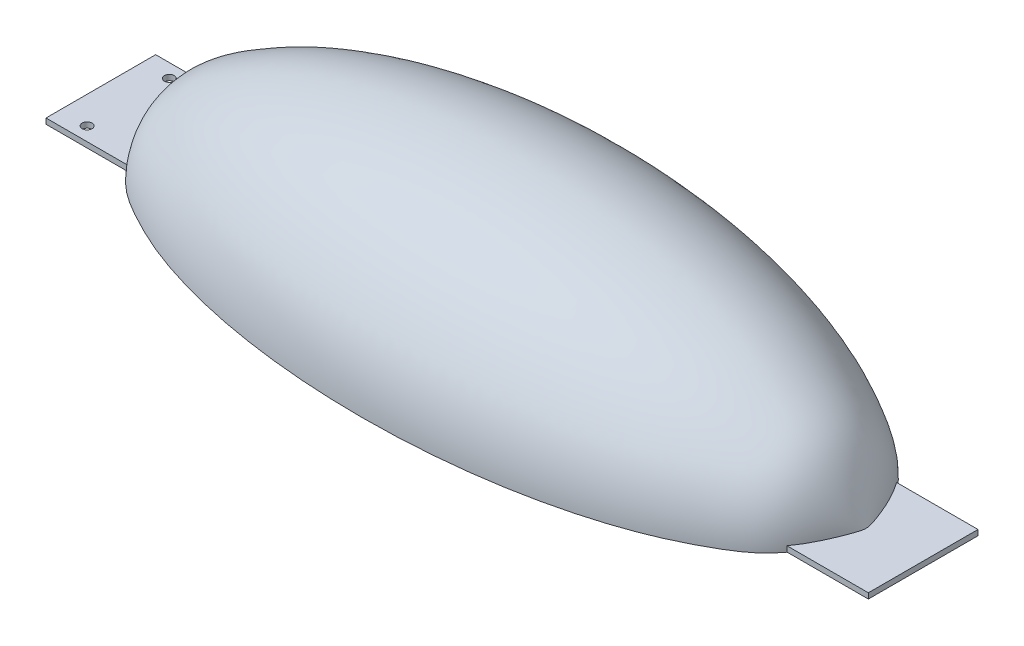
from build123d import *

# Parameters (mm, degrees)
SKETCH2_W           = 360
SKETCH2_H           = 160
CUT_EXTRUDE1_DEPTH  = 80
SKETCH3_W           = 30
SKETCH3_H           = 40
BOSS_EXTRUDE1_DEPTH = 2
SKETCH4_R           = 1.8
CUT_EXTRUDE2_DEPTH  = 3


with BuildPart() as part:
    # Sketch1 → Revolve1 (revolve)
    with BuildSketch(Plane.XY):
        with BuildLine():
            Line((-260, 0), (0, 0))
            add(Edge.make_bspline(
                [(0, 0), (-3.347287608, 8.830491747), (-8.637057756, 22.785453825), (-25.560999876, 33.02157361), (-38.692183286, 39.434199177), (-51.852349815, 44.123794884), (-64.89948422, 47.74936681), (-77.936573384, 50.514956153), (-90.95830586, 52.566616186), (-103.974926365, 53.983885889), (-116.988117972, 54.816743473), (-130, 55.091544132), (-143.011882028, 54.816743473), (-156.025073635, 53.983885889), (-169.04169414, 52.566616186), (-182.063426616, 50.514956153), (-195.10051578, 47.74936681), (-208.147650185, 44.123794884), (-221.307816714, 39.434199177), (-234.439000124, 33.02157361), (-251.362942244, 22.785453825), (-256.652712392, 8.830491747), (-260, 0)],
                knots=[0, 0, 0, 0, 0.090648646, 0.143253451, 0.191238799, 0.237211898, 0.282076785, 0.326262316, 0.37001128, 0.413479751, 0.456779596, 0.5, 0.543220404, 0.586520249, 0.62998872, 0.673737684, 0.717923215, 0.762788102, 0.808761201, 0.856746549, 0.909351354, 1, 1, 1, 1], degree=3))
        make_face()
    revolve(axis=Axis((10, 0, 0), (-1, 0, 0)))

    # Sketch2 → Cut-Extrude1 (cut)
    with BuildSketch(Plane(origin=(0, 0, 0), x_dir=(1, 0, 0), z_dir=(0, 1, 0))):
        with Locations((-130, 0)):
            Rectangle(SKETCH2_W, SKETCH2_H)
    extrude(amount=-CUT_EXTRUDE1_DEPTH, mode=Mode.SUBTRACT)

    # Sketch3 → Boss-Extrude1 (add)
    with BuildSketch(Plane(origin=(0, 0, 0), x_dir=(1, 0, 0), z_dir=(0, 1, 0))):
        with Locations((-265, 0)):
            Rectangle(SKETCH3_W, SKETCH3_H)
        with Locations((5, 0)):
            Rectangle(SKETCH3_W, SKETCH3_H)
    extrude(amount=BOSS_EXTRUDE1_DEPTH)

    # Sketch4 → Cut-Extrude2 (cut)
    with BuildSketch(Plane(origin=(0, 0, 0), x_dir=(1, 0, 0), z_dir=(0, 1, 0))):
        with Locations((-270, -15)):
            Circle(SKETCH4_R)
        with Locations((-270, 15)):
            Circle(SKETCH4_R)
    extrude(amount=CUT_EXTRUDE2_DEPTH, mode=Mode.SUBTRACT)


solid = part.part
